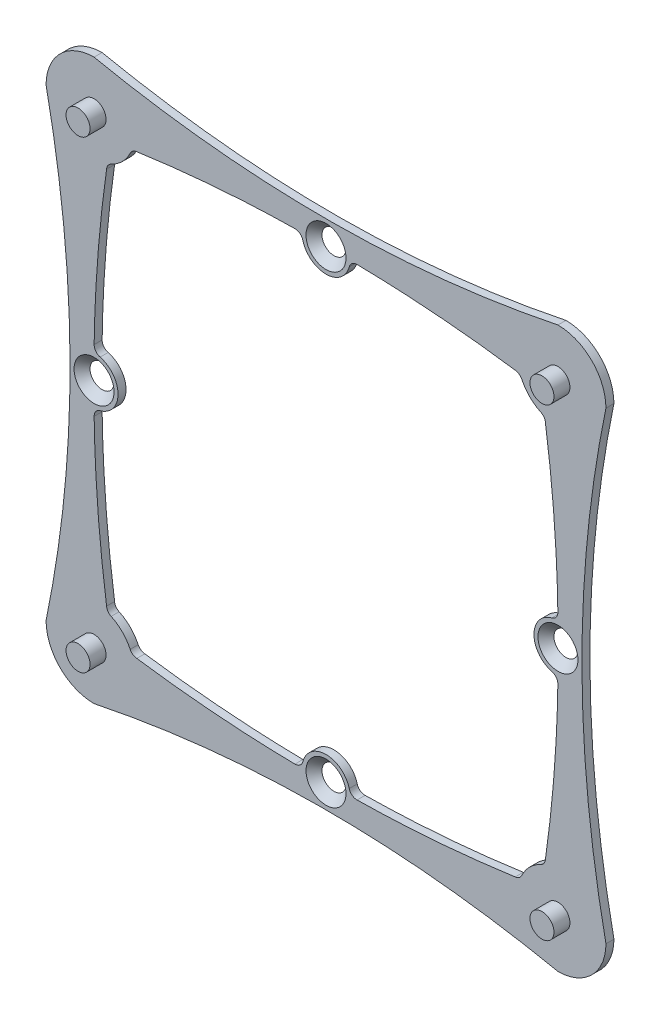
from build123d import *

# Parameters (mm, degrees)
IZIM3_R                          = 1.5
Y_KSEKLIK_EKSTR_ZYON3_DEPTH      = 1
PAH1_SIZE                        = 1
Y_KSEKLIK_EKSTR_ZYON5_DEPTH      = 2
Y_KSEKLIK_EKSTR_ZYON5_DEPTH_BACK = 1
IZIM5_R                          = 1.5
Y_KSEKLIK_EKSTR_ZYON4_DEPTH      = 2
Y_KSEKLIK_EKSTR_ZYON4_DEPTH_BACK = 1
IZIM4_R                          = 1.5


with BuildPart() as part:
    # Çizim3 → Yükseklik-Ekstrüzyon3 (new body)
    with BuildSketch(Plane.XY):
        with BuildLine():
            ThreePointArc((-29, 35), (-33.242640687, 33.242640687), (-35, 29))
            add(Edge.make_bspline(
                [(-35, -29), (-29, 0), (-35, 29)],
                knots=[0, 0, 0, 1, 1, 1], degree=2))
            ThreePointArc((-35, -29), (-33.242640687, -33.242640687), (-29, -35))
            add(Edge.make_bspline(
                [(29, -35), (0, -29), (-29, -35)],
                knots=[0, 0, 0, 1, 1, 1], degree=2))
            ThreePointArc((29, -35), (33.242640687, -33.242640687), (35, -29))
            add(Edge.make_bspline(
                [(35, 29), (29, 0), (35, -29)],
                knots=[0, 0, 0, 1, 1, 1], degree=2))
            ThreePointArc((35, 29), (33.242640687, 33.242640687), (29, 35))
            add(Edge.make_bspline(
                [(-29, 35), (0, 29), (29, 35)],
                knots=[0, 0, 0, 1, 1, 1], degree=2))
        make_face()
        with Locations((0, -29)):
            Circle(IZIM3_R, mode=Mode.SUBTRACT)
        with Locations((-29, 0)):
            Circle(IZIM3_R, mode=Mode.SUBTRACT)
        with Locations((-29, 29)):
            Circle(IZIM3_R, mode=Mode.SUBTRACT)
        with Locations((29, 29)):
            Circle(IZIM3_R, mode=Mode.SUBTRACT)
        with Locations((-29, -29)):
            Circle(IZIM3_R, mode=Mode.SUBTRACT)
        with Locations((29, -29)):
            Circle(IZIM3_R, mode=Mode.SUBTRACT)
        with Locations((0, 29)):
            Circle(IZIM3_R, mode=Mode.SUBTRACT)
        with Locations((29, 0)):
            Circle(IZIM3_R, mode=Mode.SUBTRACT)
        with BuildLine():
            ThreePointArc((-24.479955031, -26.862432812), (-25.464466094, -25.464466094), (-26.862432812, -24.479955031))
            ThreePointArc((-26.862432812, -24.479955031), (-27.257516743, -24.144570316), (-27.431672227, -23.65646778))
            add(Edge.make_bspline(
                [(-27.431672227, -23.65646778), (-28.369214102, -17.081973168), (-28.888327363, -10.491616934), (-28.989012012, -3.885399076)],
                knots=[0, 0, 0, 0, 0.836151593, 0.836151593, 0.836151593, 0.836151593], degree=3))
            ThreePointArc((-28.989012012, -3.885399076), (-28.785191285, -3.264946388), (-28.241846101, -2.902619966))
            ThreePointArc((-28.241846101, -2.902619966), (-26, 0), (-28.241846101, 2.902619966))
            ThreePointArc((-28.241846101, 2.902619966), (-28.785191285, 3.264946388), (-28.989012012, 3.885399076))
            add(Edge.make_bspline(
                [(-27.431672227, 23.65646778), (-28.369214102, 17.081973168), (-28.888327363, 10.491616934), (-28.989012012, 3.885399076)],
                knots=[0, 0, 0, 0, 0.836151593, 0.836151593, 0.836151593, 0.836151593], degree=3))
            ThreePointArc((-27.431672227, 23.65646778), (-27.257516743, 24.144570316), (-26.862432812, 24.479955031))
            ThreePointArc((-26.862432812, 24.479955031), (-25.464466094, 25.464466094), (-24.479955031, 26.862432812))
            ThreePointArc((-24.479955031, 26.862432812), (-24.144570316, 27.257516743), (-23.65646778, 27.431672227))
            add(Edge.make_bspline(
                [(-23.65646778, 27.431672227), (-17.081973168, 28.369214102), (-10.491616934, 28.888327363), (-3.885399076, 28.989012012)],
                knots=[0, 0, 0, 0, 0.836151593, 0.836151593, 0.836151593, 0.836151593], degree=3))
            ThreePointArc((-3.885399076, 28.989012012), (-3.264946388, 28.785191285), (-2.902619966, 28.241846101))
            ThreePointArc((-2.902619966, 28.241846101), (0, 26), (2.902619966, 28.241846101))
            ThreePointArc((2.902619966, 28.241846101), (3.264946388, 28.785191285), (3.885399076, 28.989012012))
            add(Edge.make_bspline(
                [(23.65646778, 27.431672227), (17.081973168, 28.369214102), (10.491616934, 28.888327363), (3.885399076, 28.989012012)],
                knots=[0, 0, 0, 0, 0.836151593, 0.836151593, 0.836151593, 0.836151593], degree=3))
            ThreePointArc((23.65646778, 27.431672227), (24.144570316, 27.257516743), (24.479955031, 26.862432812))
            ThreePointArc((24.479955031, 26.862432812), (25.464466094, 25.464466094), (26.862432812, 24.479955031))
            ThreePointArc((26.862432812, 24.479955031), (27.257516743, 24.144570316), (27.431672227, 23.65646778))
            add(Edge.make_bspline(
                [(27.431672227, 23.65646778), (28.369214102, 17.081973168), (28.888327363, 10.491616934), (28.989012012, 3.885399076)],
                knots=[0, 0, 0, 0, 0.836151593, 0.836151593, 0.836151593, 0.836151593], degree=3))
            ThreePointArc((28.989012012, 3.885399076), (28.785191285, 3.264946389), (28.241846101, 2.902619966))
            ThreePointArc((28.241846101, 2.902619966), (26, 0), (28.241846101, -2.902619966))
            ThreePointArc((28.241846101, -2.902619966), (28.785191285, -3.264946388), (28.989012012, -3.885399076))
            add(Edge.make_bspline(
                [(27.431672227, -23.65646778), (28.369214102, -17.081973168), (28.888327363, -10.491616934), (28.989012012, -3.885399076)],
                knots=[0, 0, 0, 0, 0.836151593, 0.836151593, 0.836151593, 0.836151593], degree=3))
            ThreePointArc((27.431672227, -23.65646778), (27.257516743, -24.144570316), (26.862432812, -24.479955031))
            ThreePointArc((26.862432812, -24.479955031), (25.464466094, -25.464466094), (24.479955031, -26.862432812))
            ThreePointArc((24.479955031, -26.862432812), (24.144570316, -27.257516743), (23.65646778, -27.431672227))
            add(Edge.make_bspline(
                [(23.65646778, -27.431672227), (17.081973168, -28.369214102), (10.491616934, -28.888327363), (3.885399076, -28.989012012)],
                knots=[0, 0, 0, 0, 0.836151593, 0.836151593, 0.836151593, 0.836151593], degree=3))
            ThreePointArc((3.885399076, -28.989012012), (3.264946388, -28.785191285), (2.902619966, -28.241846101))
            ThreePointArc((2.902619966, -28.241846101), (0, -26), (-2.902619966, -28.241846101))
            ThreePointArc((-2.902619966, -28.241846101), (-3.264946388, -28.785191285), (-3.885399076, -28.989012012))
            add(Edge.make_bspline(
                [(-23.65646778, -27.431672227), (-17.081973168, -28.369214102), (-10.491616934, -28.888327363), (-3.885399076, -28.989012012)],
                knots=[0, 0, 0, 0, 0.836151593, 0.836151593, 0.836151593, 0.836151593], degree=3))
            ThreePointArc((-23.65646778, -27.431672227), (-24.144570316, -27.257516743), (-24.479955031, -26.862432812))
        make_face(mode=Mode.SUBTRACT)
    extrude(amount=Y_KSEKLIK_EKSTR_ZYON3_DEPTH)

    # Pah1
    pah1_edges = [part.edges().sort_by_distance(p)[0] for p in [
        (-1.5, 29, 1),
        (27.5, 0, 1),
        (-1.5, -29, 1),
        (-30.5, 0, 1),
    ]]
    chamfer(pah1_edges, length=PAH1_SIZE - 0.0001)  # a hair under: the kernel refuses the full size

    # Çizim5 → Yükseklik-Ekstrüzyon5 (add, two sides: drawn at the far end of the back side and taken through both)
    with BuildSketch(Plane.XY.offset(1).offset(-Y_KSEKLIK_EKSTR_ZYON5_DEPTH_BACK)):
        with Locations((-29, 29)):
            Circle(IZIM5_R)
        with Locations((29, 29)):
            Circle(IZIM5_R)
        with Locations((29, -29)):
            Circle(IZIM5_R)
        with Locations((-29, -29)):
            Circle(IZIM5_R)
    extrude(amount=Y_KSEKLIK_EKSTR_ZYON5_DEPTH + Y_KSEKLIK_EKSTR_ZYON5_DEPTH_BACK)

    # Çizim4 → Yükseklik-Ekstrüzyon4 (add, two sides: drawn at the far end of the back side and taken through both)
    with BuildSketch(Plane.XY.offset(1).offset(-Y_KSEKLIK_EKSTR_ZYON4_DEPTH_BACK)):
        with Locations((-29, 29)):
            Circle(IZIM4_R)
        with Locations((29, 29)):
            Circle(IZIM4_R)
        with Locations((29, -29)):
            Circle(IZIM4_R)
        with Locations((-29, -29)):
            Circle(IZIM4_R)
    extrude(amount=Y_KSEKLIK_EKSTR_ZYON4_DEPTH + Y_KSEKLIK_EKSTR_ZYON4_DEPTH_BACK)


solid = part.part
